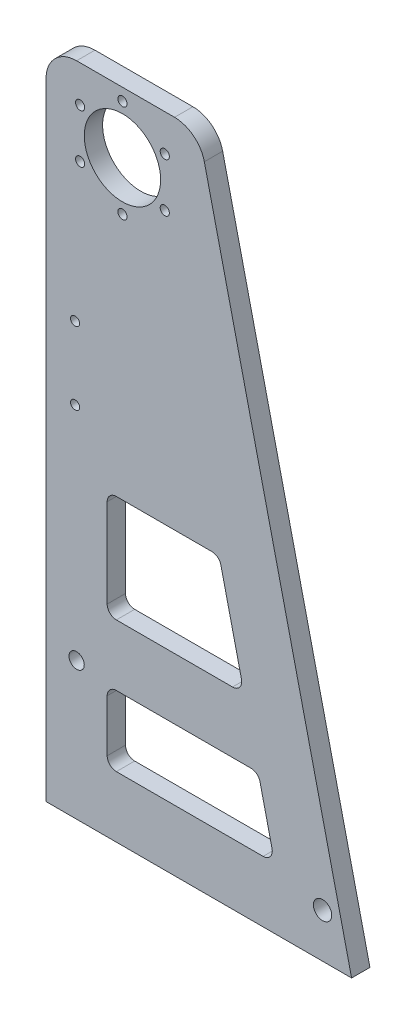
from build123d import *

# Parameters (mm, degrees)
ESBO_O1_R                = 12.5
ESBO_O1_R_2              = 1.5
ESBO_O1_R_3              = 2.5
RESSALTO_EXTRUS_O2_DEPTH = 6
FILETE1_R                = 10
ESBO_O2_R                = 3
ESBO_O2_RX               = 1.5
ESBO_O2_RY               = 1.426584774
CORTE_EXTRUS_O1_DEPTH    = 238.194013415


with BuildPart() as part:
    # Esboço1 → Ressalto-extrusão2 (new body)
    with BuildSketch(Plane.XY):
        Polygon((0, 0), (0, 215), (50, 215), (100, 0), align=None)
        with Locations((25, 195)):
            Circle(ESBO_O1_R, mode=Mode.SUBTRACT)
        with Locations((25, 211)):
            Circle(ESBO_O1_R_2, mode=Mode.SUBTRACT)
        with Locations((38.856406461, 203)):
            Circle(ESBO_O1_R_2, mode=Mode.SUBTRACT)
        with Locations((38.856406461, 187)):
            Circle(ESBO_O1_R_2, mode=Mode.SUBTRACT)
        with Locations((25, 179)):
            Circle(ESBO_O1_R_2, mode=Mode.SUBTRACT)
        with Locations((11.143593539, 187)):
            Circle(ESBO_O1_R_2, mode=Mode.SUBTRACT)
        with Locations((11.143593539, 203)):
            Circle(ESBO_O1_R_2, mode=Mode.SUBTRACT)
        with Locations((10, 45)):
            Circle(ESBO_O1_R_3, mode=Mode.SUBTRACT)
        with BuildLine():
            Line((20, 95), (20, 66))
            ThreePointArc((20, 66), (20.878679656, 63.878679656), (23, 63))
            Line((23, 63), (61.03739436, 63))
            ThreePointArc((61.03739436, 63), (63.386715693, 64.134339454), (63.959418441, 66.679540484))
            Line((63.959418441, 66.679540484), (57.215232395, 95.679540484))
            ThreePointArc((57.215232395, 95.679540484), (56.15886886, 97.349321333), (54.293208314, 98))
            Line((54.293208314, 98), (23, 98))
            ThreePointArc((23, 98), (20.878679656, 97.121320344), (20, 95))
        make_face(mode=Mode.SUBTRACT)
        with BuildLine():
            Line((20, 40), (20, 23))
            ThreePointArc((20, 23), (20.878679656, 20.878679656), (23, 20))
            Line((23, 20), (71.03739436, 20))
            ThreePointArc((71.03739436, 20), (73.386715693, 21.134339454), (73.959418441, 23.679540484))
            Line((73.959418441, 23.679540484), (70.005930069, 40.679540484))
            ThreePointArc((70.005930069, 40.679540484), (68.949566534, 42.349321333), (67.083905988, 43))
            Line((67.083905988, 43), (23, 43))
            ThreePointArc((23, 43), (20.878679656, 42.121320344), (20, 40))
        make_face(mode=Mode.SUBTRACT)
    extrude(amount=RESSALTO_EXTRUS_O2_DEPTH)

    # Filete1
    filete1_edges = [part.edges().sort_by_distance(p)[0] for p in [
        (0, 215, 3),
        (50, 215, 3),
    ]]
    fillet(filete1_edges, radius=FILETE1_R)

    # Esboço2 → Corte-extrusão1 (cut, through all)
    with BuildSketch(Plane.XY.offset(6)):
        with Locations((90.5, 14.5)):
            Circle(ESBO_O2_R)
        with Locations(Location((9.5, 117.202456767), (0, 0, 180))):
            Ellipse(ESBO_O2_RX, ESBO_O2_RY)
        with Locations(Location((9.5, 140.978869674), (0, 0, 180))):
            Ellipse(ESBO_O2_RX, ESBO_O2_RY)
    extrude(amount=-CORTE_EXTRUS_O1_DEPTH, mode=Mode.SUBTRACT)


solid = part.part
